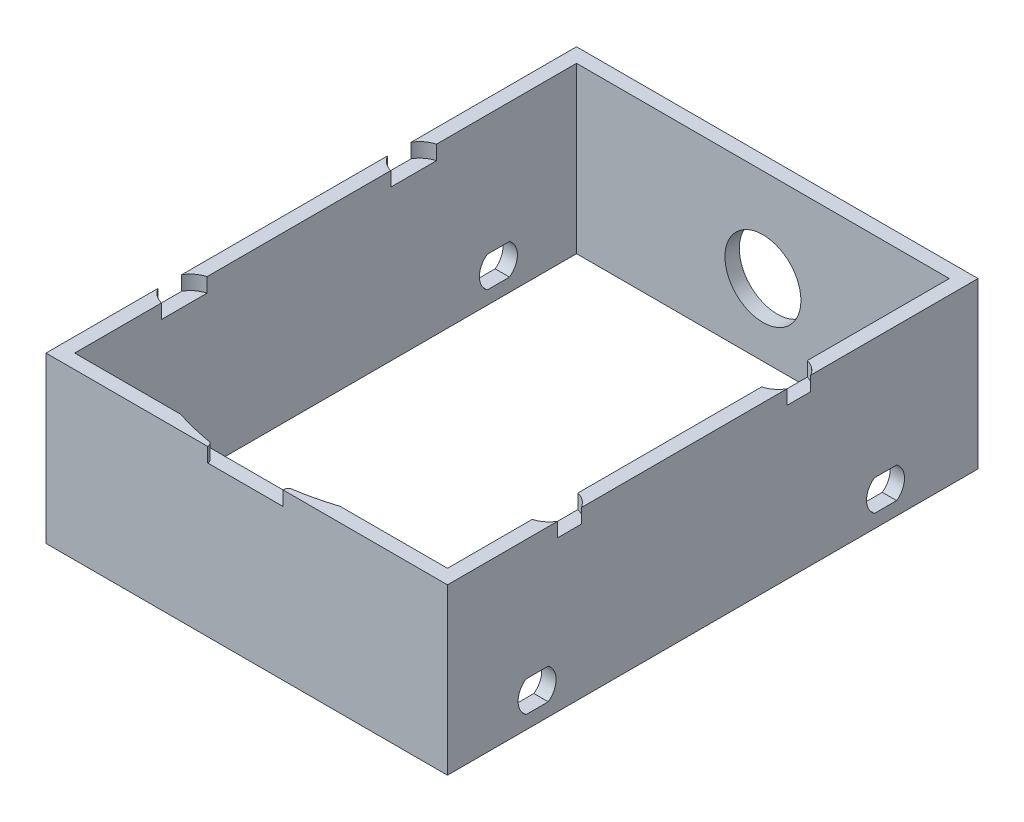
from build123d import *

# Parameters (mm, degrees)
BOSS_EXTRUDE1_DEPTH = 13
BOSS_EXTRUDE3_DEPTH = 2.3
BOSS_EXTRUDE4_DEPTH = 2.3
SPLIT1_START        = -4.6
SPLIT1_DEPTH        = 4.6
SKETCH9_W           = 56.929943861
SKETCH9_H           = 73.17042397
BOSS_EXTRUDE5_DEPTH = 34
SKETCH10_W          = 56
SKETCH10_H          = 74
SKETCH10_W_2        = 52
SKETCH10_H_2        = 70
BOSS_EXTRUDE6_DEPTH = 10
SKETCH11_W          = 56
SKETCH11_H          = 74
SKETCH11_W_2        = 52
SKETCH11_H_2        = 70
BOSS_EXTRUDE7_DEPTH = 23
CUT_EXTRUDE1_START  = -74
SKETCH7_R           = 5.3
CUT_EXTRUDE1_DEPTH  = 2
CUT_EXTRUDE2_DEPTH  = 70
CAVITY1_START       = 21.3871
CAVITY1_DEPTH       = 1.6129
SKETCH12_R          = 3.3
CUT_EXTRUDE3_DEPTH  = 2


# Read off the part's stored shape, not the designer's step: Split1, Cavity1
with BuildPart() as part:
    # Sketch1 → Boss-Extrude1 (new body)
    with BuildSketch(Plane(origin=(0, 0, 0), x_dir=(1, 0, 0), z_dir=(0, 1, 0))):
        Polygon((28, 37.2), (-28, 37.2), (-28, -36.8), (28, -36.8), (28, 0), align=None)
        Polygon((26, 0), (26, 35.2), (-26, 35.2), (-26, -34.8), (26, -34.8), align=None, mode=Mode.SUBTRACT)
    extrude(amount=BOSS_EXTRUDE1_DEPTH)


with BuildPart() as body_2:
    # Sketch5 → Boss-Extrude3 (new body)
    with BuildSketch(Plane.XZ):
        with BuildLine():
            Line((-28, 36.8), (28, 36.8))
            Line((28, 36.8), (28, -37.2))
            Line((28, -37.2), (25, -37.2))
            Line((25, -37.2), (25, -9.8))
            ThreePointArc((25, -9.8), (0, 15.2), (-25, -9.8))
            Line((-25, -9.8), (-25, -37.2))
            Line((-25, -37.2), (-28, -37.2))
            Line((-28, -37.2), (-28, 36.8))
        make_face()
    extrude(amount=BOSS_EXTRUDE3_DEPTH)

    # Sketch6 → Boss-Extrude4 (add)
    with BuildSketch(Plane.XZ.offset(2.3)):
        with BuildLine():
            Line((22.7, -37.2), (28, -37.2))
            Line((28, -37.2), (28, 36.8))
            Line((28, 36.8), (-28, 36.8))
            Line((-28, 36.8), (-28, -37.2))
            Line((-28, -37.2), (-22.7, -37.2))
            Line((-22.7, -37.2), (-22.7, -9.8))
            ThreePointArc((-22.7, -9.8), (0, 12.9), (22.7, -9.8))
            Line((22.7, -9.8), (22.7, -37.2))
        make_face()
    extrude(amount=BOSS_EXTRUDE4_DEPTH)

    # Split1 outline → Split1 (cut)
    with BuildSketch(Plane(origin=(0, 0, 0), x_dir=(1, 0, 0), z_dir=(0, 1, 0)).offset(SPLIT1_START)):
        with BuildLine():
            Line((-28, -36.8), (28, -36.8))
            Line((28, -36.8), (28, 37.2))
            Line((28, 37.2), (22.7, 37.2))
            Line((22.7, 37.2), (22.7, 9.8))
            ThreePointArc((22.7, 9.8), (0, -12.9), (-22.7, 9.8))
            Line((-22.7, 9.8), (-22.7, 37.2))
            Line((-22.7, 37.2), (-28, 37.2))
            Line((-28, 37.2), (-28, -36.8))
        make_face()
    extrude(amount=SPLIT1_DEPTH, mode=Mode.SUBTRACT)


with BuildPart() as body_2_2:
    # Sketch9 → Boss-Extrude5 (new body)
    with BuildSketch(Plane(origin=(0, 13, 0), x_dir=(-1, 0, 0), z_dir=(0, 1, 0))):
        with Locations((0.264790437, -0.308922176)):
            Rectangle(SKETCH9_W, SKETCH9_H)
    extrude(amount=BOSS_EXTRUDE5_DEPTH)


with BuildPart() as part_1:
    add(part.part)

    # Combine1: cut body 2 2
    add(body_2_2.part, mode=Mode.SUBTRACT)

    # Sketch10 → Boss-Extrude6 (add)
    with BuildSketch(Plane(origin=(0, 13, 0), x_dir=(1, 0, 0), z_dir=(0, 1, 0))):
        with Locations((0, 0.2)):
            Rectangle(SKETCH10_W, SKETCH10_H)
        with Locations((0, 0.2)):
            Rectangle(SKETCH10_W_2, SKETCH10_H_2, mode=Mode.SUBTRACT)
    extrude(amount=BOSS_EXTRUDE6_DEPTH)

    # Sketch11 → Boss-Extrude7 (add)
    with BuildSketch(Plane(origin=(0, 23, 0), x_dir=(1, 0, 0), z_dir=(0, 1, 0))):
        with Locations((0, 0.2)):
            Rectangle(SKETCH11_W, SKETCH11_H)
        with Locations((0, 0.2)):
            Rectangle(SKETCH11_W_2, SKETCH11_H_2, mode=Mode.SUBTRACT)
    extrude(amount=-BOSS_EXTRUDE7_DEPTH)

    # Sketch7 → Cut-Extrude1 (cut)
    with BuildSketch(Plane.XY.offset(36.8).offset(CUT_EXTRUDE1_START)):
        with Locations((0, 10)):
            Circle(SKETCH7_R)
    extrude(amount=CUT_EXTRUDE1_DEPTH, mode=Mode.SUBTRACT)

    # Sketch8 → Cut-Extrude2 (cut)
    with BuildSketch(Plane.ZY.offset(28)):
        with BuildLine():
            Line((22.750806662, 6.15), (25.849193338, 6.15))
            ThreePointArc((25.849193338, 6.15), (26.95, 4), (25.849193338, 1.85))
            Line((25.849193338, 1.85), (22.750806662, 1.85))
            ThreePointArc((22.750806662, 1.85), (21.65, 4), (22.750806662, 6.15))
        make_face()
        with BuildLine():
            Line((-25.849193338, 6.15), (-22.750806662, 6.15))
            ThreePointArc((-22.750806662, 6.15), (-21.65, 4), (-22.750806662, 1.85))
            Line((-22.750806662, 1.85), (-25.849193338, 1.85))
            ThreePointArc((-25.849193338, 1.85), (-26.95, 4), (-25.849193338, 6.15))
        make_face()
    extrude(amount=-CUT_EXTRUDE2_DEPTH, mode=Mode.SUBTRACT)

    # Cavity1 outline → Cavity1 (cut)
    with BuildSketch(Plane(origin=(0, 0, 0), x_dir=(1, 0, 0), z_dir=(0, 1, 0)).offset(CAVITY1_START)):
        with BuildLine():
            ThreePointArc((-28, -20.441285249), (-27.241688626, -21.665903715), (-26, -22.395928291))
            Line((-26, -22.395928291), (-26, -20.987393289))
            ThreePointArc((-26, -20.987393289), (-27.027836237, -19.527994439), (-26, -18.068595588))
            Line((-26, -18.068595588), (-26, -16.644860586))
            ThreePointArc((-26, -16.644860586), (-27.241688626, -17.374885162), (-28, -18.599503628))
            Line((-28, -18.599503628), (-28, -20.441285249))
        make_face()
        with BuildLine():
            Line((10.014130308, -34.8), (-10.23489996, -34.8))
            ThreePointArc((-10.23489996, -34.8), (-8.230538078, -35.333645486), (-6.197835522, -35.746397685))
            ThreePointArc((-6.197835522, -35.746397685), (-5.469873643, -36.018934875), (-5.147839508, -36.726394439))
            ThreePointArc((-5.147839508, -36.726394439), (-5.146895808, -36.763245519), (-5.144067255, -36.8))
            Line((-5.144067255, -36.8), (4.758391535, -36.8))
            ThreePointArc((4.758391535, -36.8), (4.761220088, -36.763245519), (4.762163763, -36.726394439))
            ThreePointArc((4.762163763, -36.726394439), (5.049199117, -36.033429793), (5.742163763, -35.746394439))
            Line((5.742163763, -35.746394439), (5.822163763, -35.746394439))
            ThreePointArc((5.822163763, -35.746394439), (7.93260454, -35.337235399), (10.014130308, -34.8))
        make_face()
        with BuildLine():
            Line((-28, 13.400496372), (-28, 11.558714751))
            ThreePointArc((-28, 11.558714751), (-27.241688626, 10.334096285), (-26, 9.604071709))
            Line((-26, 9.604071709), (-26, 11.033690962))
            ThreePointArc((-26, 11.033690962), (-26.997836237, 12.482005561), (-26, 13.930320161))
            Line((-26, 13.930320161), (-26, 15.355139414))
            ThreePointArc((-26, 15.355139414), (-27.241688626, 14.625114838), (-28, 13.400496372))
        make_face()
        with BuildLine():
            Line((26, -21.24169048), (26, -22.661132164))
            ThreePointArc((26, -22.661132164), (27.243136742, -21.927868824), (28, -20.698957885))
            Line((28, -20.698957885), (28, -18.873830992))
            ThreePointArc((28, -18.873830992), (27.243136742, -17.644920054), (26, -16.911656713))
            Line((26, -16.911656713), (26, -18.334298397))
            ThreePointArc((26, -18.334298397), (27.012163763, -19.787994439), (26, -21.24169048))
        make_face()
        with BuildLine():
            ThreePointArc((26, 9.338867836), (27.243136742, 10.072131176), (28, 11.301042115))
            Line((28, 11.301042115), (28, 13.126169008))
            ThreePointArc((28, 13.126169008), (27.243136742, 14.355079946), (26, 15.088343287))
            Line((26, 15.088343287), (26, 13.682945544))
            ThreePointArc((26, 13.682945544), (27.032163763, 12.222005562), (26, 10.761065579))
            Line((26, 10.761065579), (26, 9.338867836))
        make_face()
    extrude(amount=CAVITY1_DEPTH, mode=Mode.SUBTRACT)

    # Sketch12 → Cut-Extrude3 (cut)
    with BuildSketch(Plane(origin=(0, 23, 0), x_dir=(1, 0, 0), z_dir=(0, 1, 0))):
        with Locations((-25.144836237, 12.479605561)):
            Circle(SKETCH12_R)
        with Locations((25.142163763, 12.213605561)):
            Circle(SKETCH12_R)
        with Locations((25.142163763, -19.786394439)):
            Circle(SKETCH12_R)
        with Locations((-25.144836237, -19.520394439)):
            Circle(SKETCH12_R)
        with BuildLine():
            Line((-5.144067255, -36.8), (4.758391535, -36.8))
            Line((4.758391535, -36.8), (5.062163763, -36.8))
            Line((5.062163763, -36.8), (5.062163763, -36.726394439))
            ThreePointArc((5.062163763, -36.726394439), (5.261331152, -36.245561827), (5.742163763, -36.046394439))
            Line((5.742163763, -36.046394439), (5.870241965, -36.042516857))
            ThreePointArc((5.870241965, -36.042516857), (8.935204114, -35.405039737), (11.932081344, -34.5))
            Line((11.932081344, -34.5), (-12.110811403, -34.5))
            ThreePointArc((-12.110811403, -34.5), (-9.196992953, -35.402634382), (-6.215562743, -36.047739555))
            ThreePointArc((-6.215562743, -36.047739555), (-5.68493716, -36.228763375), (-5.447661294, -36.736733155))
            Line((-5.447661294, -36.736733155), (-5.447661294, -36.8))
            Line((-5.447661294, -36.8), (-5.144067255, -36.8))
        make_face()
    extrude(amount=-CUT_EXTRUDE3_DEPTH, mode=Mode.SUBTRACT)


solid = part_1.part
